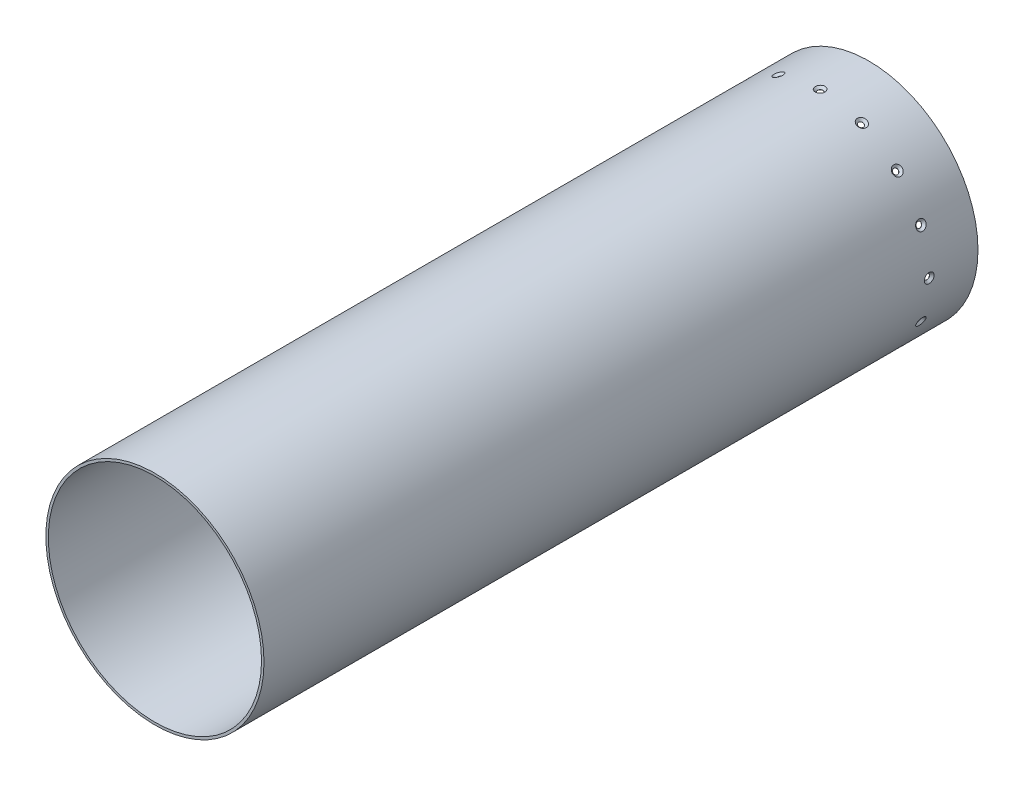
from build123d import *

# Parameters (mm, degrees)
SKETCH1_R                                       = 69.85
SKETCH1_R_2                                     = 68.2625
EXTRUDE1_DEPTH                                  = 457.2
CSK_FOR_M3_FLAT_HEAD_MACHINE_SCREW1_D           = 3.4
CSK_FOR_M3_FLAT_HEAD_MACHINE_SCREW1_CSINK_D     = 6.3
CSK_FOR_M3_FLAT_HEAD_MACHINE_SCREW1_CSINK_ANGLE = 90
CIRPATTERN1_COUNT                               = 16
F_10_CLEARANCE_HOLE1_D                          = 5.1054
F_10_CLEARANCE_HOLE1_DEPTH                      = 12.7
F_10_CLEARANCE_HOLE1_TIP                        = 1.533816902


with BuildPart() as part:
    # Sketch1 → Extrude1 (new body)
    with BuildSketch(Plane.XY):
        Circle(SKETCH1_R)
        Circle(SKETCH1_R_2, mode=Mode.SUBTRACT)
    extrude(amount=EXTRUDE1_DEPTH)

    # CSK for M3 Flat Head Machine Screw1 (through all)
    with Locations(Plane(origin=(0, -69.85, 31.242), x_dir=(1, 0, 0), z_dir=(0, -1, 0))):
        with Locations((0, 0)):
            csk_for_m3_flat_head_machine_screw1 = CounterSinkHole(CSK_FOR_M3_FLAT_HEAD_MACHINE_SCREW1_D / 2, CSK_FOR_M3_FLAT_HEAD_MACHINE_SCREW1_CSINK_D / 2, counter_sink_angle=CSK_FOR_M3_FLAT_HEAD_MACHINE_SCREW1_CSINK_ANGLE)

    # CirPattern1: CSK for M3 Flat Head Machine Screw1 ×16 about axis
    cirpattern1_axis = Axis((0, 0, 457.2), (0, 0, -1))
    for i in range(1, CIRPATTERN1_COUNT):
        add(csk_for_m3_flat_head_machine_screw1.rotate(cirpattern1_axis, i * 360 / CIRPATTERN1_COUNT), mode=Mode.SUBTRACT)

    # #10 Clearance Hole1
    with Locations(Plane(origin=(13.627058993, -68.507851836, 31.242), x_dir=(0.9807852804032304, 0.19509032201612855, 0), z_dir=(0.19509032201612853, -0.9807852804032303, 0))):
        with Locations((0, 0)):
            Hole(F_10_CLEARANCE_HOLE1_D / 2, depth=F_10_CLEARANCE_HOLE1_DEPTH)
            with Locations((0, 0, -(F_10_CLEARANCE_HOLE1_DEPTH + F_10_CLEARANCE_HOLE1_TIP / 2))):  # 118° drill point
                Cone(0, F_10_CLEARANCE_HOLE1_D / 2, F_10_CLEARANCE_HOLE1_TIP, mode=Mode.SUBTRACT)


solid = part.part
